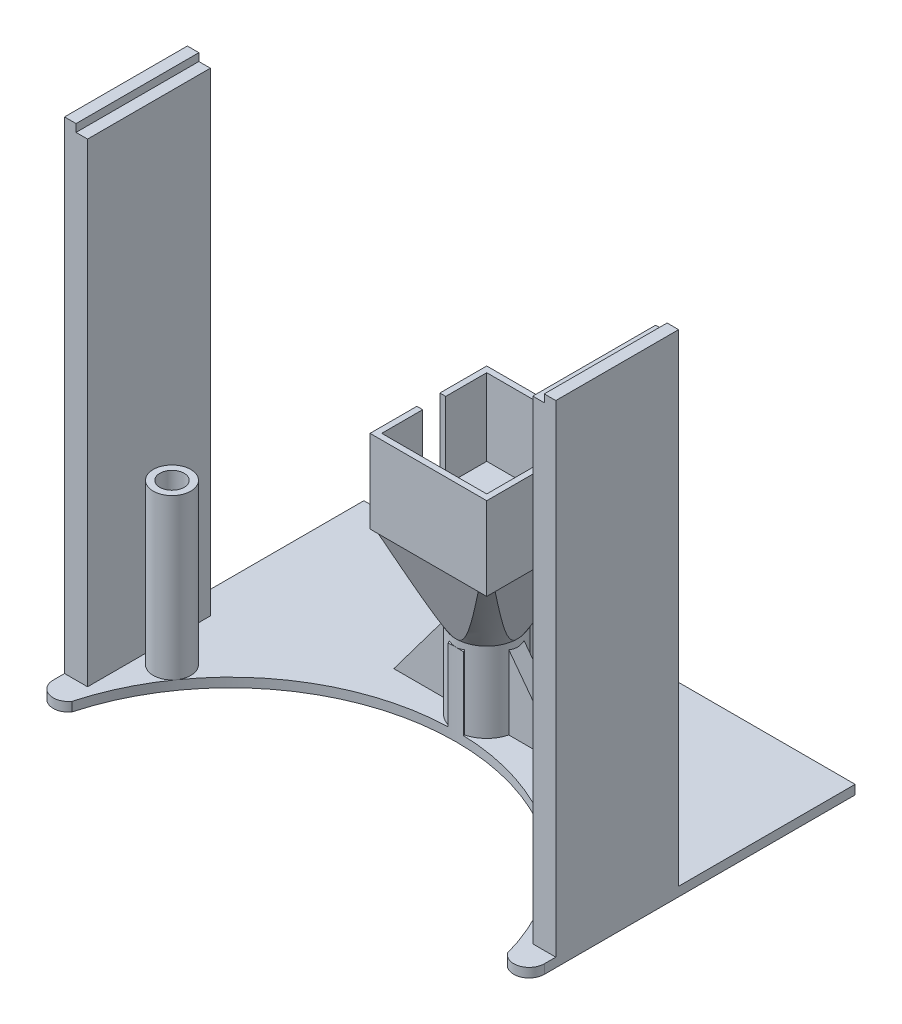
from build123d import *
from build123d.topology import SkipClean

# Parameters (mm, degrees)
SKETCH1_W           = 203.2
SKETCH1_H           = 152.4
BOSS_EXTRUDE1_DEPTH = 3.81
SKETCH2_R           = 12.7
BOSS_EXTRUDE2_DEPTH = 69.85
SKETCH3_W           = 48.26
SKETCH3_H           = 48.26
BOSS_EXTRUDE3_DEPTH = 2.54
BOSS_EXTRUDE4_DEPTH = 31.75
BOUNDARY6_START     = -3.175
BOUNDARY6_DEPTH     = 6.35
CIRPATTERN2_COUNT   = 4
CHAMFER1_SIZE       = 19.05
CHAMFER1_SIZE_2     = 32.995567884
CUT_EXTRUDE2_DEPTH  = 193.290749908
CIRPATTERN3_COUNT   = 4
CUT_EXTRUDE3_DEPTH  = 44
FILLET2_R           = 6.35
CUT_EXTRUDE5_REACH  = 170.037
SKETCH20_W          = 9.525
SKETCH20_H          = 50.8
BOSS_EXTRUDE5_DEPTH = 200.025
SKETCH22_R          = 7.756774687
SKETCH22_R_2        = 5.05
BOSS_EXTRUDE6_DEPTH = 69.85
SKETCH23_R          = 5.05
BOSS_EXTRUDE7_DEPTH = 57.15
SKETCH24_W          = 4.7625
SKETCH24_H          = 50.8
BOSS_EXTRUDE8_DEPTH = 3.175


# Read off the part's stored shape, not the designer's step: Boundary6
with BuildPart() as part:
    # Sketch1 → Boss-Extrude1 (new body)
    with BuildSketch(Plane(origin=(0, 0, 0), x_dir=(1, 0, 0), z_dir=(0, 1, 0))):
        with Locations((0, -25.4)):
            Rectangle(SKETCH1_W, SKETCH1_H)
    extrude(amount=BOSS_EXTRUDE1_DEPTH)

    # Sketch2 → Boss-Extrude2 (add)
    with BuildSketch(Plane(origin=(0, 0, 0), x_dir=(1, 0, 0), z_dir=(0, 1, 0))):
        with Locations(Location((0, 0, 0), (0, 0, 270))):
            Circle(SKETCH2_R)
    extrude(amount=BOSS_EXTRUDE2_DEPTH)

    # Sketch3 → Boss-Extrude3 (add)
    with BuildSketch(Plane(origin=(0, 69.85, 0), x_dir=(1, 0, 0), z_dir=(0, 1, 0))):
        Rectangle(SKETCH3_W, SKETCH3_H)
    extrude(amount=BOSS_EXTRUDE3_DEPTH)

    # Sketch5 → Boss-Extrude4 (add)
    with BuildSketch(Plane(origin=(0, 72.39, 0), x_dir=(1, 0, 0), z_dir=(0, 1, 0))):
        Polygon((24.13, -24.13), (24.13, 24.13), (-24.13, 24.13), (-24.13, 4.7625), (-21.717, 4.7625), (-21.717, 21.717), (21.717, 21.717), (21.717, -21.717), (-21.717, -21.717), (-21.717, -4.7625), (-24.13, -4.7625), (-24.13, -24.13), align=None)
    extrude(amount=BOSS_EXTRUDE4_DEPTH)

    # Boundary6 outline → Boundary6 (add)
    with BuildSketch(Plane.YZ.offset(BOUNDARY6_START)):
        Polygon((3.81, -35.2425), (34.404370501, -12.296722124), (36, -11.1), (36, -11), (3.81, -11), align=None)
    boundary6 = extrude(amount=BOUNDARY6_DEPTH)

    # CirPattern2: Boundary6 ×4 about axis
    cirpattern2_axis = Axis((0, 0, 0), (0, 1, 0))
    for i in range(1, CIRPATTERN2_COUNT):
        add(boundary6.rotate(cirpattern2_axis, i * 360 / CIRPATTERN2_COUNT))

    # Chamfer1
    # the kernel refuses this chamfer: 32.995567884, 19.05 mm, written as the material it adds along each edge
    with BuildSketch(Plane(origin=(0, 69.85, 0), x_dir=(0, 0, 1), z_dir=(-1, 0, 0))) as chamfer1_piece_1_section:
        Polygon((12.7 + CHAMFER1_SIZE, 0), (12.7, -CHAMFER1_SIZE_2), (12.7, 0), align=None)
    chamfer1_piece_1 = revolve(axis=Axis((0, 69.85, 0), (0, 1, 0)), mode=Mode.PRIVATE)
    chamfer1_piece_1 = split(chamfer1_piece_1, bisect_by=Plane(origin=(0, 53.518076003, -24.13), z_dir=(0, 0, 1)), keep=Keep.TOP, mode=Mode.PRIVATE)
    chamfer1_piece_1 = split(chamfer1_piece_1, bisect_by=Plane(origin=(-24.13, 53.518076003, -21.937722148), z_dir=(1, 0, 0)), keep=Keep.TOP, mode=Mode.PRIVATE)
    chamfer1_piece_1 = split(chamfer1_piece_1, bisect_by=Plane(origin=(24.13, 53.518076003, -21.937722148), z_dir=(-1, 0, 0)), keep=Keep.TOP, mode=Mode.PRIVATE)
    chamfer1_piece_1 = split(chamfer1_piece_1, bisect_by=Plane(origin=(0, 53.518076003, 24.13), z_dir=(0, 0, -1)), keep=Keep.TOP, mode=Mode.PRIVATE)
    add(chamfer1_piece_1)

    # Sketch16 → Cut-Extrude2 (cut, through all)
    with SkipClean():  # the faces are left unmerged after this step: merging them gives an invalid solid
        with BuildSketch(Plane.ZY.offset(24.13)):
            Polygon((-24.13, 56.651772846), (-12.7, 36.854432116), (-24.13, 69.85), align=None)
        cut_extrude2 = extrude(amount=-CUT_EXTRUDE2_DEPTH, mode=Mode.SUBTRACT)

    # CirPattern3: Cut-Extrude2 ×4 about axis
    cirpattern3_axis = Axis((0, 0, 0), (0, 1, 0))
    for i in range(1, CIRPATTERN3_COUNT):
        add(cut_extrude2.rotate(cirpattern3_axis, i * 360 / CIRPATTERN3_COUNT), mode=Mode.SUBTRACT)

    # Sketch17 → Cut-Extrude3 (cut)
    with BuildSketch(Plane(origin=(0, 3.81, 0), x_dir=(1, 0, 0), z_dir=(0, 1, 0))):
        with BuildLine():
            ThreePointArc((101.6, -101.6), (60.675113939, -53.301458322), (0, -35.2425))
            ThreePointArc((0, -35.2425), (-60.675113939, -53.301458322), (-101.6, -101.6))
            Line((-101.6, -101.6), (101.6, -101.6))
        make_face()
    extrude(amount=-CUT_EXTRUDE3_DEPTH, mode=Mode.SUBTRACT)

    # Fillet2
    fillet2_edges = [part.edges().sort_by_distance(p)[0] for p in [
        (101.6, 1.905, 101.6),
        (-101.6, 1.905, 101.6),
    ]]
    fillet(fillet2_edges, radius=FILLET2_R)

    # Sketch18 → Cut-Extrude5 (cut, up to next)
    with BuildSketch(Plane(origin=(0, 0, 0), x_dir=(1, 0, 0), z_dir=(0, 1, 0)), mode=Mode.PRIVATE) as cut_extrude5_sk1:
        with BuildLine():
            ThreePointArc((90.094050479, -81.433222166), (50.622427702, -47.463153623), (0, -35.2425))
            ThreePointArc((0, -35.2425), (-50.622427702, -47.463153623), (-90.094050479, -81.433222166))
            ThreePointArc((-90.094050479, -81.433222166), (0, -12.7), (90.094050479, -81.433222166))
        make_face()
    cut_extrude5_tool1 = extrude(cut_extrude5_sk1.sketch, amount=CUT_EXTRUDE5_REACH, mode=Mode.PRIVATE) & part.part
    add(cut_extrude5_tool1.solids().sort_by_distance((51.502274, 0, 45.747032))[0], mode=Mode.SUBTRACT)

    # Sketch20 → Boss-Extrude5 (add)
    with BuildSketch(Plane(origin=(0, 0, 0), x_dir=(1, 0, 0), z_dir=(0, 1, 0))):
        with Locations((-96.8375, -47.625)):
            Rectangle(SKETCH20_W, SKETCH20_H)
        with Locations((96.8375, -47.625)):
            Rectangle(SKETCH20_W, SKETCH20_H)
    extrude(amount=BOSS_EXTRUDE5_DEPTH)

    # Sketch22 → Boss-Extrude6 (add)
    # profile 1 of 2: a face of its own
    with BuildSketch(Plane(origin=(0, 0, 0), x_dir=(1, 0, 0), z_dir=(0, 1, 0))):
        with Locations(Location((-82.55, -47.625, 0), (0, 0, 324.681399532))):
            Circle(SKETCH22_R)
        with Locations(Location((-82.55, -47.625, 0), (0, 0, 270))):
            Circle(SKETCH22_R_2, mode=Mode.SUBTRACT)
    # profile 2 of 2: a face of its own
    with BuildSketch(Plane(origin=(0, 0, 0), x_dir=(1, 0, 0), z_dir=(0, 1, 0))):
        with Locations(Location((82.55, -47.625, 0), (0, 0, 215.318041944))):
            Circle(SKETCH22_R)
        with Locations(Location((82.55, -47.625, 0), (0, 0, 270))):
            Circle(SKETCH22_R_2, mode=Mode.SUBTRACT)
    extrude(amount=BOSS_EXTRUDE6_DEPTH)

    # Sketch23 → Boss-Extrude7 (add)
    with BuildSketch(Plane(origin=(0, 3.81, 0), x_dir=(1, 0, 0), z_dir=(0, 1, 0))):
        with Locations(Location((-82.55, -47.625, 0), (0, 0, 270))):
            Circle(SKETCH23_R)
        with Locations(Location((82.55, -47.625, 0), (0, 0, 270))):
            Circle(SKETCH23_R)
    extrude(amount=BOSS_EXTRUDE7_DEPTH)

    # Sketch24 → Boss-Extrude8 (add)
    with BuildSketch(Plane(origin=(0, 200.025, 0), x_dir=(1, 0, 0), z_dir=(0, 1, 0))):
        with Locations((-99.21875, -47.625)):
            Rectangle(SKETCH24_W, SKETCH24_H)
        with Locations((99.21875, -47.625)):
            Rectangle(SKETCH24_W, SKETCH24_H)
    extrude(amount=BOSS_EXTRUDE8_DEPTH)


solid = part.part
